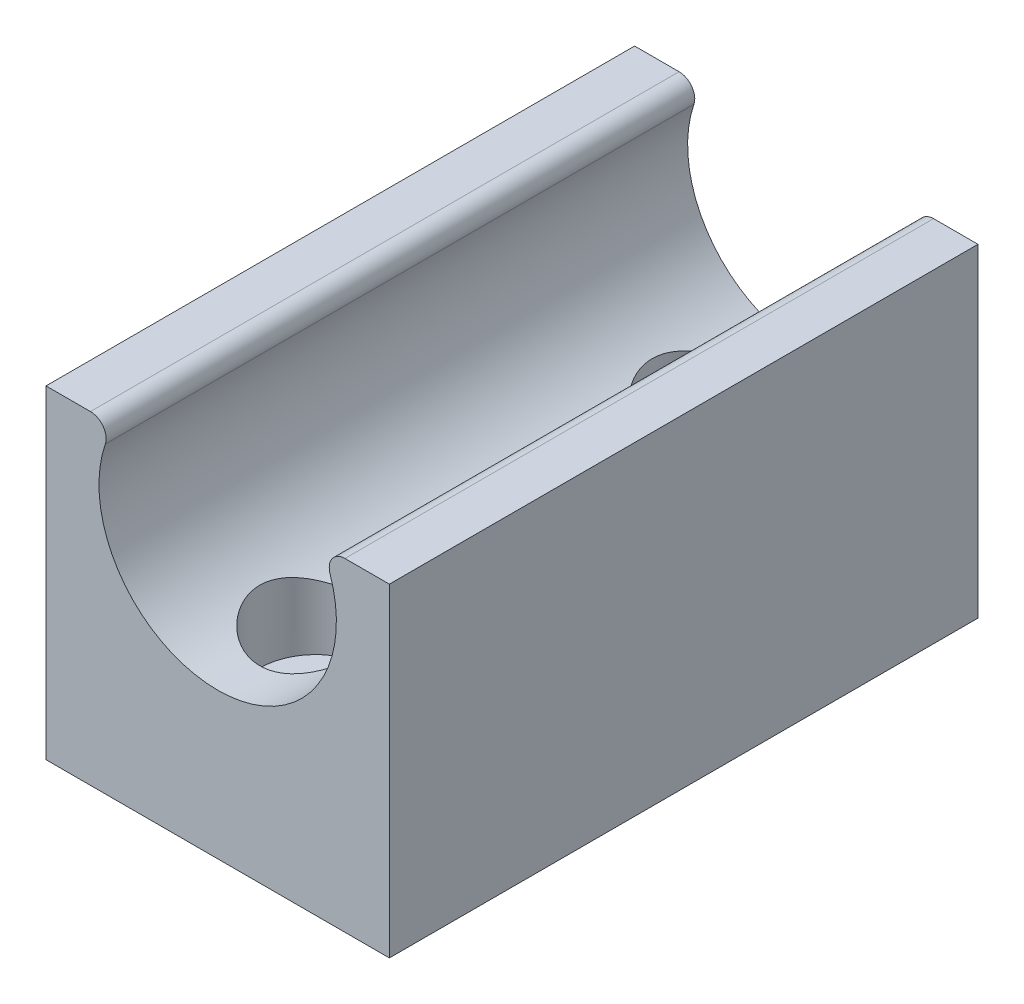
from build123d import *

# Parameters (mm, degrees)
BOSS_EXTRUDE1_DEPTH = 30
FILLET1_R           = 0.8
SKETCH3_R           = 2.85
CUT_EXTRUDE1_DEPTH  = 12
SKETCH4_R           = 1.55
CUT_EXTRUDE2_DEPTH  = 36.338541368


with BuildPart() as part:
    # Sketch1 → Boss-Extrude1 (new body)
    with BuildSketch(Plane.XY):
        with BuildLine():
            Line((-5.25, 8.25), (-8.75, 8.25))
            Line((-8.75, 8.25), (-8.75, -8.25))
            Line((-8.75, -8.25), (8.75, -8.25))
            Line((8.75, -8.25), (8.75, 8.25))
            Line((8.75, 8.25), (5.25, 8.25))
            ThreePointArc((5.25, 8.25), (0, -0.806659276), (-5.25, 8.25))
        make_face()
    extrude(amount=BOSS_EXTRUDE1_DEPTH)

    # Fillet1
    fillet1_edges = [part.edges().sort_by_distance(p)[0] for p in [
        (5.25, 8.25, 15),
        (-5.25, 8.25, 15),
    ]]
    fillet(fillet1_edges, radius=FILLET1_R)

    # Sketch3 → Cut-Extrude1 (cut)
    with BuildSketch(Plane(origin=(0, 8.25, 0), x_dir=(1, 0, 0), z_dir=(0, 1, 0))):
        with Locations((0, -5)):
            Circle(SKETCH3_R)
        with Locations((0, -25)):
            Circle(SKETCH3_R)
    extrude(amount=-CUT_EXTRUDE1_DEPTH, mode=Mode.SUBTRACT)

    # Sketch4 → Cut-Extrude2 (cut, through all)
    with BuildSketch(Plane(origin=(0, 8.25, 0), x_dir=(1, 0, 0), z_dir=(0, 1, 0))):
        with Locations((0, -5)):
            Circle(SKETCH4_R)
        with Locations((0, -25)):
            Circle(SKETCH4_R)
    extrude(amount=-CUT_EXTRUDE2_DEPTH, mode=Mode.SUBTRACT)


solid = part.part
